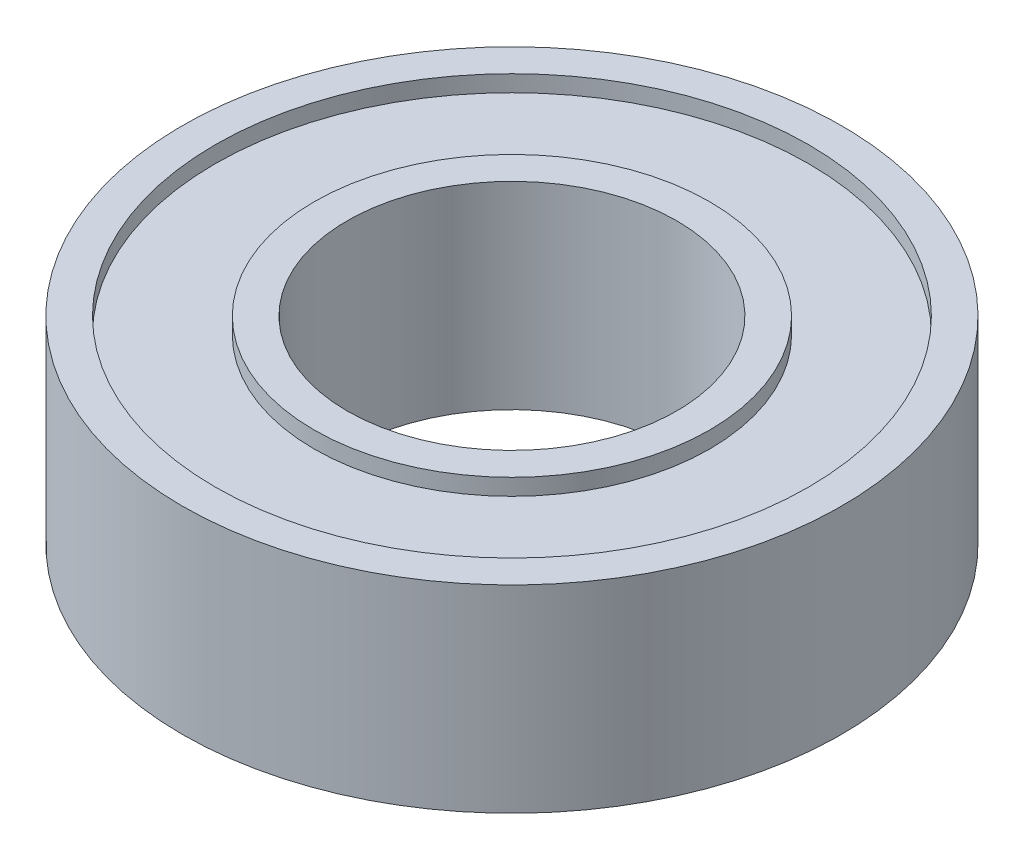
from build123d import *

# Parameters (mm, degrees)
SKETCH1_R           = 5
SKETCH1_R_2         = 2.5
BOSS_EXTRUDE1_DEPTH = 3
SKETCH2_R           = 4.5
SKETCH2_R_2         = 3
CUT_EXTRUDE1_DEPTH  = 0.25
CUT_EXTRUDE2_START  = -0.25
SKETCH3_R           = 4.5
SKETCH3_R_2         = 3
CUT_EXTRUDE2_DEPTH  = 0.25


with BuildPart() as part:
    # Sketch1 → Boss-Extrude1 (new body)
    with BuildSketch(Plane(origin=(0, 0, 0), x_dir=(1, 0, 0), z_dir=(0, 1, 0))):
        Circle(SKETCH1_R)
        Circle(SKETCH1_R_2, mode=Mode.SUBTRACT)
    extrude(amount=BOSS_EXTRUDE1_DEPTH)

    # Sketch2 → Cut-Extrude1 (cut)
    with BuildSketch(Plane.XZ):
        Circle(SKETCH2_R)
        Circle(SKETCH2_R_2, mode=Mode.SUBTRACT)
    extrude(amount=-CUT_EXTRUDE1_DEPTH, mode=Mode.SUBTRACT)

    # Sketch3 → Cut-Extrude2 (cut)
    with BuildSketch(Plane(origin=(0, 3, 0), x_dir=(1, 0, 0), z_dir=(0, 1, 0)).offset(CUT_EXTRUDE2_START)):
        Circle(SKETCH3_R)
        Circle(SKETCH3_R_2, mode=Mode.SUBTRACT)
    extrude(amount=CUT_EXTRUDE2_DEPTH, mode=Mode.SUBTRACT)


solid = part.part
